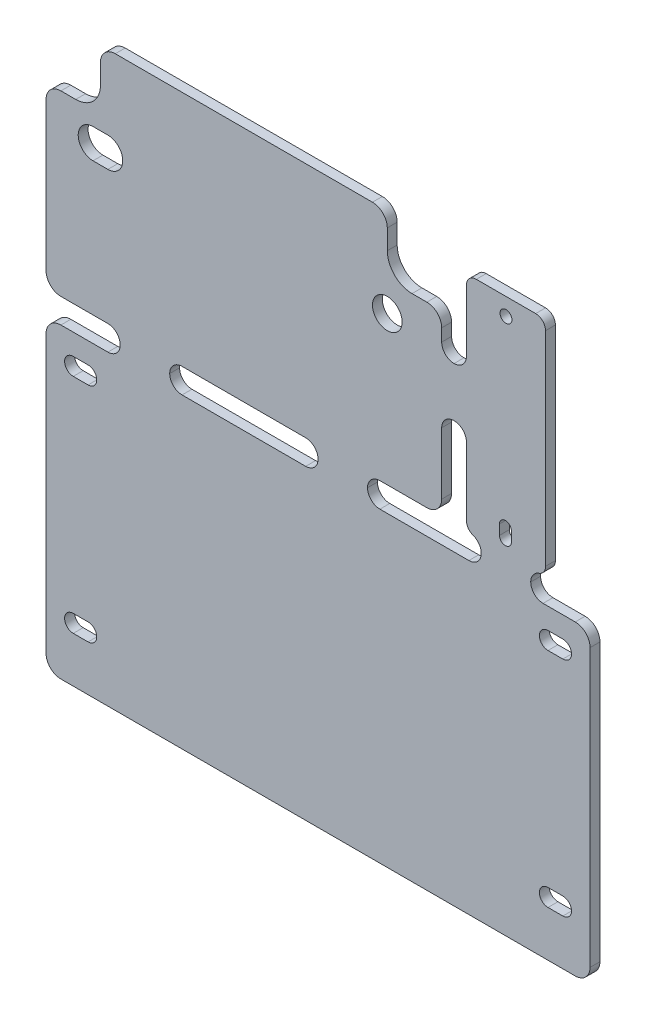
from build123d import *

# Parameters (mm, degrees)
SKETCH_1_W          = 110
SKETCH_1_H          = 65
EXTRUDE_1_DEPTH     = 2
FILLET_1_R          = 3
SKETCH_2_R          = 3
EXTRUDE_2_DEPTH     = 2
FILLET_5_R          = 3
FILLET_6_R          = 5
SKETCH_4_W          = 10
SKETCH_4_H          = 5
EXTRUDE_4_DEPTH     = 2
FILLET_7_R          = 2.5
SKETCH_5_W          = 16
SKETCH_5_H          = 45
SKETCH_5_R          = 1.2
EXTRUDE_5_DEPTH     = 2
SKETCH_6_W          = 10
SKETCH_6_H          = 5
SKETCH_6_W_2        = 5
SKETCH_6_H_2        = 10
EXTRUDE_6_DEPTH     = 2
FILLET_8_R          = 2.5
FILLET_9_R          = 2
SKETCH_7_W          = 110
SKETCH_7_H          = 3
CUT_EXTRUDE_1_DEPTH = 10
FILLET_10_R         = 3


with BuildPart() as part:
    # ｽｹｯﾁ1 → ﾎﾞｽ - 押し出し1 (new body)
    with BuildSketch(Plane.XY):
        Rectangle(SKETCH_1_W, SKETCH_1_H)
        with BuildLine():
            Line((-49.5, 24.75), (-46.5, 24.75))
            ThreePointArc((-46.5, 24.75), (-44.75, 26.5), (-46.5, 28.25))
            Line((-46.5, 28.25), (-49.5, 28.25))
            ThreePointArc((-49.5, 28.25), (-51.25, 26.5), (-49.5, 24.75))
        make_face(mode=Mode.SUBTRACT)
        with BuildLine():
            Line((-46.5, -20.25), (-49.5, -20.25))
            ThreePointArc((-49.5, -20.25), (-51.25, -18.5), (-49.5, -16.75))
            Line((-49.5, -16.75), (-46.5, -16.75))
            ThreePointArc((-46.5, -16.75), (-44.75, -18.5), (-46.5, -20.25))
        make_face(mode=Mode.SUBTRACT)
        with BuildLine():
            Line((46.5, -20.25), (49.5, -20.25))
            ThreePointArc((49.5, -20.25), (51.25, -18.5), (49.5, -16.75))
            Line((49.5, -16.75), (46.5, -16.75))
            ThreePointArc((46.5, -16.75), (44.75, -18.5), (46.5, -20.25))
        make_face(mode=Mode.SUBTRACT)
        with BuildLine():
            Line((46.5, 28.25), (49.5, 28.25))
            ThreePointArc((49.5, 28.25), (51.25, 26.5), (49.5, 24.75))
            Line((49.5, 24.75), (46.5, 24.75))
            ThreePointArc((46.5, 24.75), (44.75, 26.5), (46.5, 28.25))
        make_face(mode=Mode.SUBTRACT)
    extrude(amount=EXTRUDE_1_DEPTH)

    # ﾌｨﾚｯﾄ1
    fillet_1_edges = [part.edges().sort_by_distance(p)[0] for p in [
        (-55, 32.5, 1),
        (55, 32.5, 1),
    ]]
    fillet(fillet_1_edges, radius=FILLET_1_R)



with BuildPart() as body_2:
    # ｽｹｯﾁ2 → ﾎﾞｽ - 押し出し2 (new body)
    with BuildSketch(Plane.XY.offset(2)):
        Polygon((-55, 37.5), (25, 37.5), (25, 73.5), (14, 73.5), (14, 85.5), (-44, 85.5), (-44, 73.5), (-55, 73.5), align=None)
        with Locations((14, 67.5)):
            Circle(SKETCH_2_R, mode=Mode.SUBTRACT)
        with BuildLine():
            Line((-45.5, 64.5), (-42.5, 64.5))
            ThreePointArc((-42.5, 64.5), (-39.5, 67.5), (-42.5, 70.5))
            Line((-42.5, 70.5), (-45.5, 70.5))
            ThreePointArc((-45.5, 70.5), (-48.5, 67.5), (-45.5, 64.5))
        make_face(mode=Mode.SUBTRACT)
    extrude(amount=-EXTRUDE_2_DEPTH)

    # ﾌｨﾚｯﾄ5
    fillet_5_edges = [body_2.edges().sort_by_distance(p)[0] for p in [
        (25, 37.5, 1),
        (-55, 37.5, 1),
        (-55, 73.5, 1),
        (-44, 85.5, 1),
        (14, 85.5, 1),
        (25, 73.5, 1),
    ]]
    fillet(fillet_5_edges, radius=FILLET_5_R)

    # ﾌｨﾚｯﾄ6
    fillet_6_edges = [body_2.edges().sort_by_distance(p)[0] for p in [
        (-44, 73.5, 1),
        (14, 73.5, 1),
    ]]
    fillet(fillet_6_edges, radius=FILLET_6_R)


with BuildPart() as part_1:
    add(part.part)

    add(body_2.part)  # ﾎﾞｽ - 押し出し4 merges body 2
    # ｽｹｯﾁ4 → ﾎﾞｽ - 押し出し4 (add)
    with BuildSketch(Plane.XY.offset(2)):
        with Locations((-35, 35)):
            Rectangle(SKETCH_4_W, SKETCH_4_H)
        with Locations((5, 35)):
            Rectangle(SKETCH_4_W, SKETCH_4_H)
    extrude(amount=-EXTRUDE_4_DEPTH)

    # ﾌｨﾚｯﾄ7
    fillet_7_edges = [part_1.edges().sort_by_distance(p)[0] for p in [
        (10, 37.5, 1),
        (10, 32.5, 1),
        (0, 37.5, 1),
        (0, 32.5, 1),
        (-30, 37.5, 1),
        (-30, 32.5, 1),
        (-40, 37.5, 1),
        (-40, 32.5, 1),
    ]]
    fillet(fillet_7_edges, radius=FILLET_7_R - 0.0001)  # a hair under: the kernel refuses the full size



with BuildPart() as body_2_2:
    # ｽｹｯﾁ5 → ﾎﾞｽ - 押し出し5 (new body)
    with BuildSketch(Plane.XY.offset(2)):
        with Locations((38, 60)):
            Rectangle(SKETCH_5_W, SKETCH_5_H)
        with Locations((38, 79)):
            Circle(SKETCH_5_R, mode=Mode.SUBTRACT)
        with BuildLine():
            Line((36.683223365, 42), (36.683223365, 40))
            ThreePointArc((36.683223365, 40), (37.883223365, 38.8), (39.083223365, 40))
            Line((39.083223365, 40), (39.083223365, 42))
            ThreePointArc((39.083223365, 42), (37.883223365, 43.2), (36.683223365, 42))
        make_face(mode=Mode.SUBTRACT)
    extrude(amount=-EXTRUDE_5_DEPTH)


with BuildPart() as part_2:
    add(part_1.part)

    add(body_2_2.part)  # ﾎﾞｽ - 押し出し6 merges body 2 2
    # ｽｹｯﾁ6 → ﾎﾞｽ - 押し出し6 (add)
    with BuildSketch(Plane.XY.offset(2)):
        with Locations((38, 35)):
            Rectangle(SKETCH_6_W, SKETCH_6_H)
        with Locations((27.5, 60.5)):
            Rectangle(SKETCH_6_W_2, SKETCH_6_H_2)
    extrude(amount=-EXTRUDE_6_DEPTH)

    # ﾌｨﾚｯﾄ8
    fillet_8_edges = [part_2.edges().sort_by_distance(p)[0] for p in [
        (43, 32.5, 1),
        (43, 37.5, 1),
        (33, 32.5, 1),
        (33, 37.5, 1),
        (30, 55.5, 1),
        (25, 55.5, 1),
        (25, 65.5, 1),
        (30, 65.5, 1),
    ]]
    fillet(fillet_8_edges, radius=FILLET_8_R - 0.0001)  # a hair under: the kernel refuses the full size

    # ﾌｨﾚｯﾄ9
    fillet_9_edges = [part_2.edges().sort_by_distance(p)[0] for p in [
        (46, 82.5, 1),
        (30, 82.5, 1),
        (46, 37.5, 1),
        (30, 37.5, 1),
    ]]
    fillet(fillet_9_edges, radius=FILLET_9_R)

    # ｽｹｯﾁ7 → ｶｯﾄ - 押し出し1 (cut)
    with BuildSketch(Plane.XY.offset(2)):
        with Locations((0, -31)):
            Rectangle(SKETCH_7_W, SKETCH_7_H)
    extrude(amount=-CUT_EXTRUDE_1_DEPTH, mode=Mode.SUBTRACT)

    # ﾌｨﾚｯﾄ10
    fillet_10_edges = [part_2.edges().sort_by_distance(p)[0] for p in [
        (55, -29.5, 1),
        (-55, -29.5, 1),
    ]]
    fillet(fillet_10_edges, radius=FILLET_10_R)


solid = part_2.part
